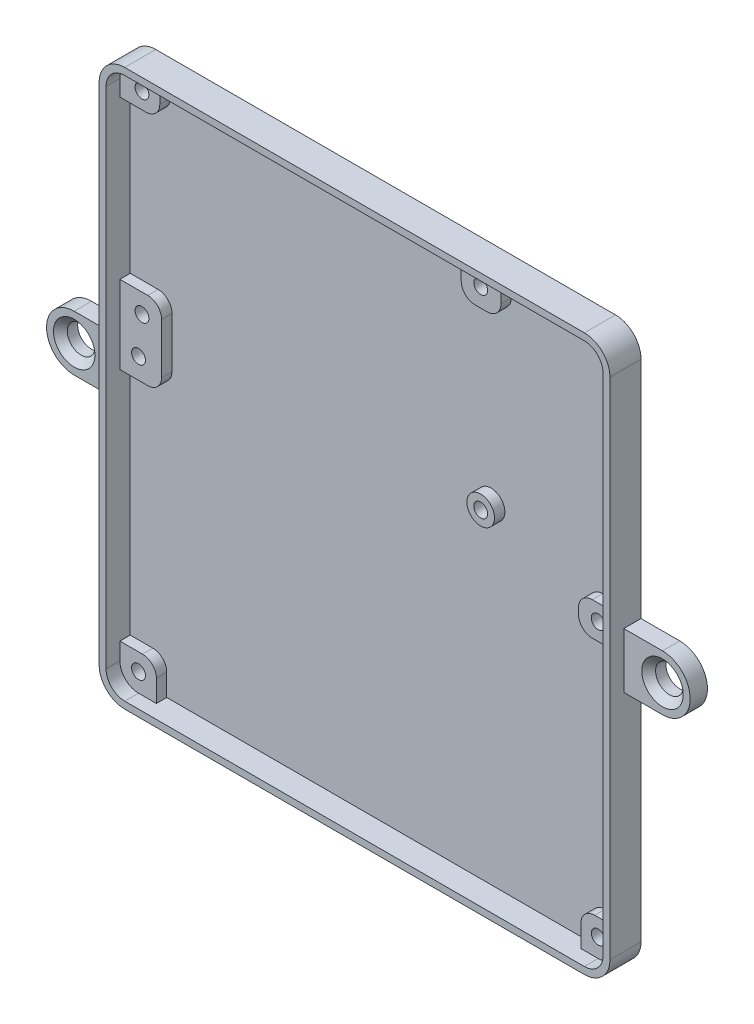
from build123d import *

# Parameters (mm, degrees)
EXTRUDE_1_DEPTH     = 1
EXTRUDE_2_DEPTH     = 4.5
SKETCH_4_R          = 2
EXTRUDE_3_DEPTH     = 2.5
CHAMFER_1_SIZE      = 1
EXTRUDE_4_OUTLINE_R = 2
EXTRUDE_4_DEPTH     = 1.5
SKETCH_6_R          = 1
CUT_EXTRUDE_1_DEPTH = 115.249760713


# Read off the part's stored shape, not the designer's step: Бобышка-Вытянуть4
with BuildPart() as part:
    # Эскиз2 → Бобышка-Вытянуть1 (new body)
    with BuildSketch(Plane.XY):
        with BuildLine():
            Line((2.50000008, 78.20000148), (68.99999916, 78.19999894))
            ThreePointArc((68.99999916, 78.19999894), (70.909187526, 77.409187226), (71.69999924, 75.49999886))
            Line((71.69999924, 75.49999886), (71.70000051, 2.500002823))
            ThreePointArc((71.70000051, 2.500002823), (70.909189394, 0.590811786), (68.99999916, -0.20000127))
            Line((68.99999916, -0.20000127), (2.50000008, -0.20000127))
            ThreePointArc((2.50000008, -0.20000127), (0.590809846, 0.590811786), (-0.20000127, 2.500002823))
            Line((-0.20000127, 2.500002823), (-0.20000254, 75.49999886))
            ThreePointArc((-0.20000254, 75.49999886), (0.590809918, 77.409189022), (2.50000008, 78.20000148))
        make_face()
    extrude(amount=EXTRUDE_1_DEPTH)

    # Эскиз3 → Бобышка-Вытянуть2 (add)
    with BuildSketch(Plane.XY):
        with BuildLine():
            Line((-1.20000254, 75.49999886), (-1.20000127, 2.500002806))
            ThreePointArc((-1.20000127, 2.500002806), (-0.116296929, -0.116295001), (2.50000008, -1.20000127))
            Line((2.50000008, -1.20000127), (68.99999916, -1.20000127))
            ThreePointArc((68.99999916, -1.20000127), (71.616296534, -0.116294636), (72.70000051, 2.500003839))
            Line((72.70000051, 2.500003839), (72.69999924, 75.499998877))
            ThreePointArc((72.69999924, 75.499998877), (71.616294301, 78.116294013), (68.99999916, 79.19999894))
            Line((68.99999916, 79.19999894), (2.50000008, 79.20000148))
            ThreePointArc((2.50000008, 79.20000148), (-0.116296863, 78.116295803), (-1.20000254, 75.49999886))
        make_face()
        with BuildLine():
            Line((-0.20000254, 75.49999886), (-0.20000127, 2.500002823))
            ThreePointArc((-0.20000127, 2.500002823), (0.590809846, 0.590811786), (2.50000008, -0.20000127))
            Line((2.50000008, -0.20000127), (68.99999916, -0.20000127))
            ThreePointArc((68.99999916, -0.20000127), (70.909189394, 0.590811786), (71.70000051, 2.500002823))
            Line((71.70000051, 2.500002823), (71.69999924, 75.49999886))
            ThreePointArc((71.69999924, 75.49999886), (70.909187526, 77.409187226), (68.99999916, 78.19999894))
            Line((68.99999916, 78.19999894), (2.50000008, 78.20000148))
            ThreePointArc((2.50000008, 78.20000148), (0.590809918, 77.409189022), (-0.20000254, 75.49999886))
        make_face(mode=Mode.SUBTRACT)
    extrude(amount=EXTRUDE_2_DEPTH)


with BuildPart() as extrude_3_tool:
    # Эскиз4 → Бобышка-Вытянуть3 (new body)
    # profile 1 of 2: a face of its own
    with BuildSketch(Plane.XY):
        with BuildLine():
            Line((-6.805028483, 42.99999886), (-1.200001975, 42.99999886))
            Line((-1.200001975, 42.99999886), (-1.200001835, 34.99999886))
            Line((-1.200001835, 34.99999886), (-6.805028483, 34.99999886))
            ThreePointArc((-6.805028483, 34.99999886), (-10.805028483, 38.99999886), (-6.805028483, 42.99999886))
        make_face()
        with Locations((-6.805028483, 38.99999886)):
            Circle(SKETCH_4_R, mode=Mode.SUBTRACT)
    # profile 2 of 2: a face of its own
    with BuildSketch(Plane.XY):
        with BuildLine():
            Line((72.700001075, 34.99999886), (78.305027723, 34.99999886))
            ThreePointArc((78.305027723, 34.99999886), (82.305027723, 38.99999886), (78.305027723, 42.99999886))
            Line((78.305027723, 42.99999886), (72.700001215, 42.99999886))
            Line((72.700001215, 42.99999886), (72.700001075, 34.99999886))
        make_face()
        with Locations(Location((78.305027723, 38.99999886, 0), (0, 0, 180))):
            Circle(SKETCH_4_R, mode=Mode.SUBTRACT)
    extrude(amount=EXTRUDE_3_DEPTH)


with BuildPart() as part_1:
    add(part.part)


with BuildPart() as part_2:
    # Бобышка-Вытянуть3: joined with extrude_3_tool
    add(part_1.part.fuse(extrude_3_tool.part, tol=0.00001))

    # Фаска1
    chamfer_1_edges = [part_2.edges().sort_by_distance(p)[0] for p in [
        (-8.805028483, 38.99999886, 2.5),
        (80.305027723, 38.99999886, 2.5),
    ]]
    chamfer(chamfer_1_edges, length=CHAMFER_1_SIZE)

    # Бобышка-Вытянуть4 outline → Бобышка-Вытянуть4 (add)
    with BuildSketch(Plane.XY.offset(1)):
        with BuildLine():
            Line((68.14600291, 39.521136107), (71.699999866, 39.521136107))
            Line((71.699999866, 39.521136107), (71.699999782, 44.345437587))
            Line((71.699999782, 44.345437587), (68.14600291, 44.345437587))
            ThreePointArc((68.14600291, 44.345437587), (66.731789347, 43.75965115), (66.14600291, 42.345437587))
            Line((66.14600291, 42.345437587), (66.14600291, 41.521136107))
            ThreePointArc((66.14600291, 41.521136107), (66.731789347, 40.106922544), (68.14600291, 39.521136107))
        make_face()
        with BuildLine():
            Line((66.497946234, 2.977437415), (66.497946234, -0.20000127))
            Line((66.497946234, -0.20000127), (68.99999916, -0.20000127))
            ThreePointArc((68.99999916, -0.20000127), (70.909189394, 0.590811786), (71.70000051, 2.500002823))
            Line((71.70000051, 2.500002823), (71.700000467, 4.977437415))
            Line((71.700000467, 4.977437415), (68.497946234, 4.977437415))
            ThreePointArc((68.497946234, 4.977437415), (67.083732671, 4.391650978), (66.497946234, 2.977437415))
        make_face()
        with BuildLine():
            Line((54.934013046, 78.199999477), (49.186165717, 78.199999697))
            Line((49.186165717, 78.199999697), (49.186165717, 74.793776217))
            ThreePointArc((49.186165717, 74.793776217), (49.771952154, 73.379562654), (51.186165717, 72.793776217))
            Line((51.186165717, 72.793776217), (52.934013046, 72.793776217))
            ThreePointArc((52.934013046, 72.793776217), (54.348226608, 73.379562655), (54.934013046, 74.793776217))
            Line((54.934013046, 74.793776217), (54.934013046, 78.199999477))
        make_face()
        with BuildLine():
            Line((-0.20000254, 75.49999886), (-0.200002499, 73.133544525))
            Line((-0.200002499, 73.133544525), (3.577150519, 73.133544525))
            ThreePointArc((3.577150519, 73.133544525), (4.991364081, 73.719330963), (5.577150519, 75.133544525))
            Line((5.577150519, 75.133544525), (5.577150519, 78.200001362))
            Line((5.577150519, 78.200001362), (2.50000008, 78.20000148))
            ThreePointArc((2.50000008, 78.20000148), (0.590809918, 77.409189022), (-0.20000254, 75.49999886))
        make_face()
        with BuildLine():
            Line((-0.200002102, 50.30535038), (-0.200001905, 39.000000842))
            Line((-0.200001905, 39.000000842), (3.837355963, 39.000000842))
            ThreePointArc((3.837355963, 39.000000842), (5.251569526, 39.585787279), (5.837355963, 41.000000842))
            Line((5.837355963, 41.000000842), (5.837355963, 48.30535038))
            ThreePointArc((5.837355963, 48.30535038), (5.251569526, 49.719563943), (3.837355963, 50.30535038))
            Line((3.837355963, 50.30535038), (-0.200002102, 50.30535038))
        make_face()
        with BuildLine():
            ThreePointArc((5.080506282, 2.977437415), (4.494719845, 4.391650977), (3.080506282, 4.977437415))
            Line((3.080506282, 4.977437415), (-0.200001313, 4.977437415))
            Line((-0.200001313, 4.977437415), (-0.20000127, 2.500002823))
            ThreePointArc((-0.20000127, 2.500002823), (0.590809846, 0.590811786), (2.50000008, -0.20000127))
            Line((2.50000008, -0.20000127), (5.080506282, -0.20000127))
            Line((5.080506282, -0.20000127), (5.080506282, 2.977437415))
        make_face()
        with Locations((52.00000014, 47.49999898)):
            Circle(EXTRUDE_4_OUTLINE_R)
    extrude(amount=EXTRUDE_4_DEPTH)

    # Эскиз6 → Вырез-Вытянуть1 (cut, through all)
    with BuildSketch(Plane.XY.offset(2.5)):
        with Locations((52.00000014, 75.49999886)):
            Circle(SKETCH_6_R)
        with Locations((2.99999908, 75.49999886)):
            Circle(SKETCH_6_R)
        with Locations((2.99999908, 47.49999898)):
            Circle(SKETCH_6_R)
        with Locations((2.50000008, 41.99999982)):
            Circle(SKETCH_6_R)
        with Locations((2.50000008, 2.50000008)):
            Circle(SKETCH_6_R)
        with Locations((68.99999916, 2.50000008)):
            Circle(SKETCH_6_R)
        with Locations((68.99999916, 41.99999982)):
            Circle(SKETCH_6_R)
        with Locations((52.00000014, 47.49999898)):
            Circle(SKETCH_6_R)
    extrude(amount=-CUT_EXTRUDE_1_DEPTH, mode=Mode.SUBTRACT)


solid = part_2.part
